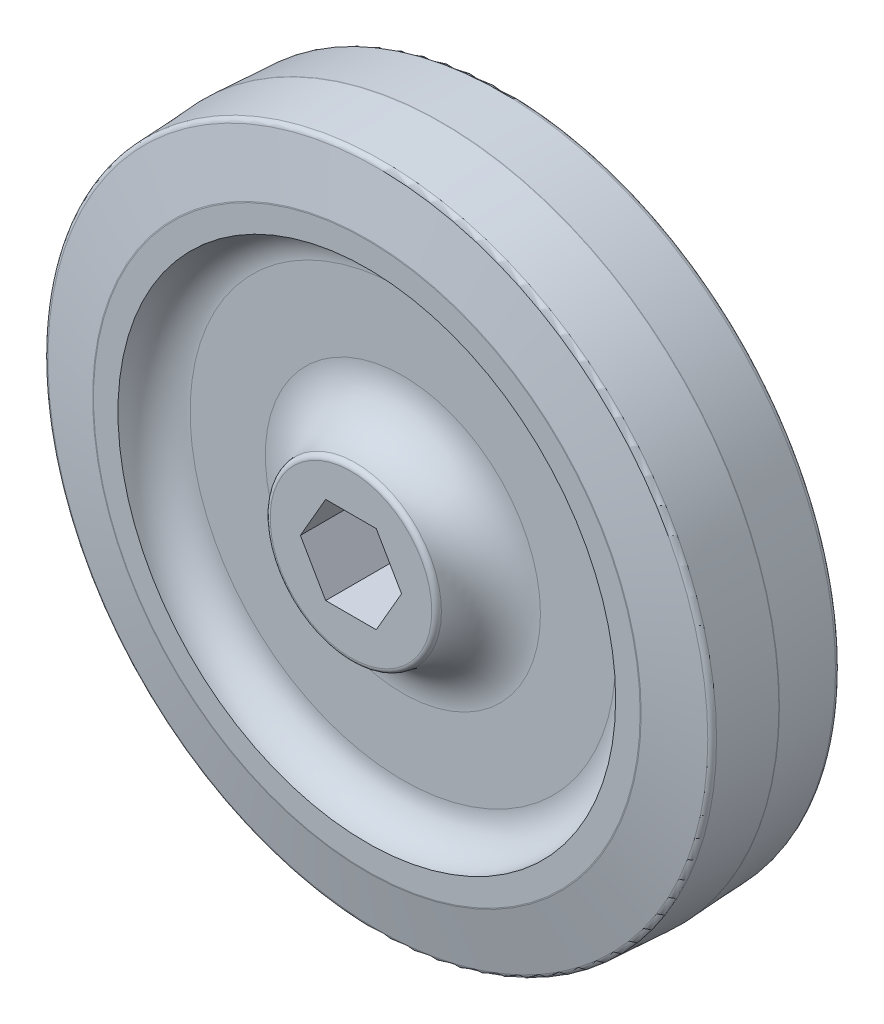
from build123d import *

# Parameters (mm, degrees)
FILLET1_R          = 7.7
FILLET2_R          = 5.35
FILLET3_R          = 0.75
CUT_EXTRUDE1_DEPTH = 76.688758176


with BuildPart() as part:
    # Sketch1 → Revolve1 (revolve)
    with BuildSketch(Plane(origin=(0, 0, 0), x_dir=(1, 0, 0), z_dir=(0, 1, 0))):
        Polygon((0, 0), (12.7, 0), (12.7, 7.7), (36.9, 7.7), (36.9, 2.35), (40.6, 2.35), (49.5, 4.1), (50, 13.5), (49.5, 22.9), (40.6, 24.65), (36.9, 24.65), (36.9, 19.3), (12.7, 19.3), (12.7, 27), (0, 27), align=None)
    revolve(axis=Axis((0, 0, 284.527359171), (0, 0, -1)))

    # Fillet1
    fillet1_edges = [part.edges().sort_by_distance(p)[0] for p in [
        (-12.7, 0, -7.7),
        (-12.7, 0, -19.3),
    ]]
    fillet(fillet1_edges, radius=FILLET1_R - 0.0001)  # a hair under: the kernel refuses the full size

    # Fillet2
    fillet2_edges = [part.edges().sort_by_distance(p)[0] for p in [
        (-36.9, 0, -7.7),
        (-36.9, 0, -19.3),
    ]]
    fillet(fillet2_edges, radius=FILLET2_R - 0.0001)  # a hair under: the kernel refuses the full size

    # Fillet3
    fillet3_edges = [part.edges().sort_by_distance(p)[0] for p in [
        (-49.5, 0, -22.9),
        (-50, 0, -13.5),
        (-49.5, 0, -4.1),
        (-40.6, 0, -2.35),
        (-12.7, 0, 0),
        (-12.7, 0, -27),
        (-40.6, 0, -24.65),
    ]]
    fillet(fillet3_edges, radius=FILLET3_R)

    # Sketch2 → Cut-Extrude1 (cut, through all)
    with BuildSketch(Plane.XY):
        Polygon((-3.75, 6.495190528), (-7.5, 0), (-3.75, -6.495190528), (3.75, -6.495190528), (7.5, 0), (3.75, 6.495190528), align=None)
    extrude(amount=-CUT_EXTRUDE1_DEPTH, mode=Mode.SUBTRACT)


solid = part.part
